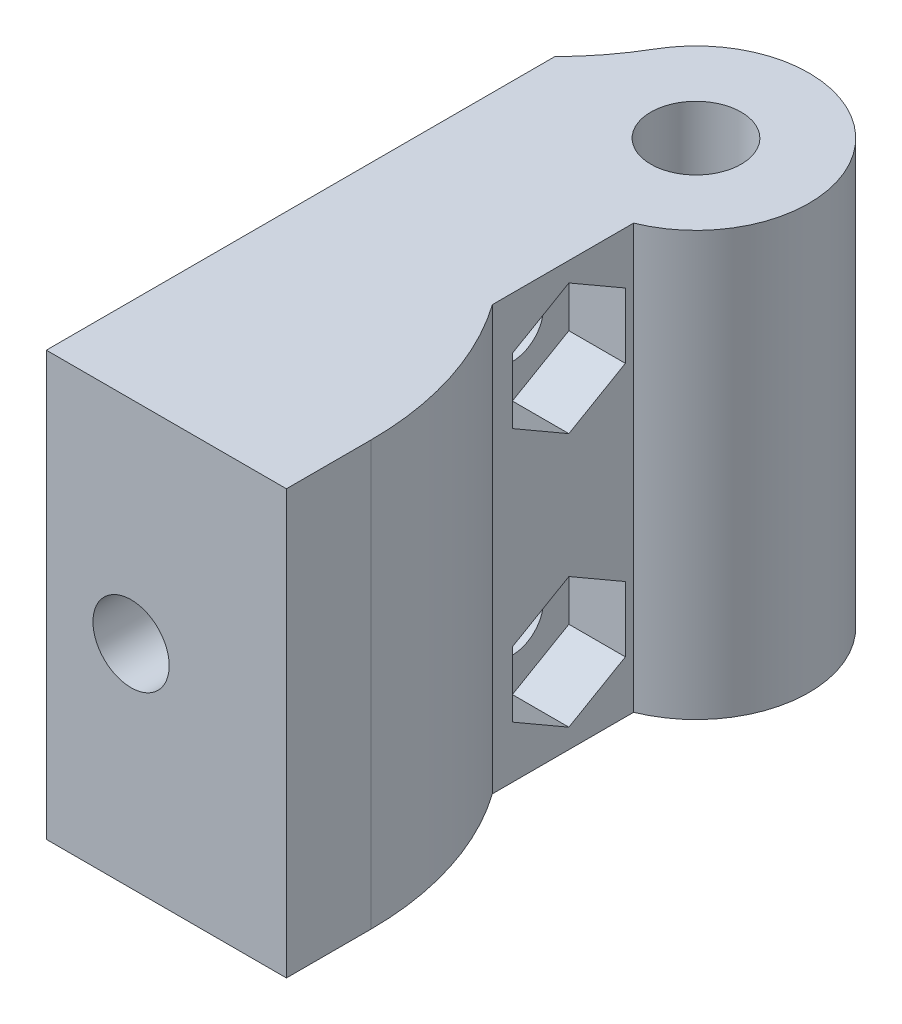
from build123d import *

# Parameters (mm, degrees)
SKETCH_1_R               = 1.6
EXTRUDE_1_DEPTH          = 7.5
CUT_EXTRUDE_1_DEPTH      = 21.554804791
CUT_EXTRUDE_1_DEPTH_BACK = 21.554804791
SKETCH_3_R               = 1.1
FILLET_1_R               = 10
SKETCH_6_R               = 1.35
CUT_EXTRUDE_2_DEPTH      = 4
SKETCH_7_W               = 4
SKETCH_7_H               = 5
CUT_EXTRUDE_3_DEPTH      = 6
CUT_EXTRUDE_4_DEPTH      = 21.554804791
CUT_EXTRUDE_4_DEPTH_BACK = 2


with BuildPart() as part:
    # 草图1 → 凸台-拉伸1 (new, symmetric)
    with BuildSketch(Plane(origin=(0, 0, 0), x_dir=(1, 0, 0), z_dir=(0, 1, 0))):
        with BuildLine():
            Line((-5, -18), (3.5, -18))
            Line((3.5, -18), (3.5, -15))
            ThreePointArc((3.5, -15), (2.987970346, -11.698938991), (1.5, -8.708099244))
            Line((1.5, -8.708099244), (1.5, -3.708099244))
            ThreePointArc((1.5, -3.708099244), (2.236067977, 3.31662479), (-4, 0))
            Line((-4, 0), (-5, 0))
            Line((-5, 0), (-5, -18))
        make_face()
        with Locations(Location((0, 0, 0), (0, 0, 270))):
            Circle(SKETCH_1_R, mode=Mode.SUBTRACT)
    extrude(amount=EXTRUDE_1_DEPTH, both=True)

    # 草图3 → 切除-拉伸1 (cut, two sides: drawn at the far end of the back side and taken through both)
    with BuildSketch(Plane(origin=(1.5, 0, 0), x_dir=(0, 0, -1), z_dir=(1, 0, 0)).offset(-CUT_EXTRUDE_1_DEPTH_BACK)):
        with Locations((-6, 4.5)):
            Circle(SKETCH_3_R)
        with Locations(Location((-6, -4.5, 0), (0, 0, 180))):
            Circle(SKETCH_3_R)
    extrude(amount=CUT_EXTRUDE_1_DEPTH + CUT_EXTRUDE_1_DEPTH_BACK, mode=Mode.SUBTRACT)

    # 圆角1
    # the kernel refuses this fillet: 10 mm, written as the material it adds along each edge
    with BuildSketch(Plane(origin=(-4, 7.5, 0), x_dir=(-1, 0, 0), z_dir=(0, -1, 0))) as fillet_1_piece_1:
        with BuildLine():
            CenterArc((8.1, 7.042016757), FILLET_1_R, 210.198757023, 14.566327648)
            Line((-0.542857143, 2.012004788), (-0.715714286, 1.911404548))
            ThreePointArc((-0.715714286, 1.911404548), (-0.331193265, 0.989877337), (-0.2, 0))
            Line((-0.2, 0), (0, -0.2))
            ThreePointArc((0, -0.2), (0.5, -0.2), (0.858, -0.140840335))
            Line((0.858, -0.140840335), (1, 0))
        make_face()
    extrude(amount=15)

    # 草图6 → 切除-拉伸2 (cut)
    with BuildSketch(Plane.XY.offset(18)):
        with Locations((-2, 0)):
            Circle(SKETCH_6_R)
    extrude(amount=-CUT_EXTRUDE_2_DEPTH, mode=Mode.SUBTRACT)

    # 草图7 → 切除-拉伸3 (cut)
    with BuildSketch(Plane.ZY.offset(5)):
        with Locations((13, 0)):
            Rectangle(SKETCH_7_W, SKETCH_7_H)
    extrude(amount=-CUT_EXTRUDE_3_DEPTH, mode=Mode.SUBTRACT)

    # 草图8 → 切除-拉伸4 (cut, two sides: drawn at the far end of the back side and taken through both)
    with BuildSketch(Plane(origin=(1.5, 0, 0), x_dir=(0, 0, -1), z_dir=(1, 0, 0)).offset(-CUT_EXTRUDE_4_DEPTH_BACK)):
        Polygon((-8, 5.654700538), (-8, 3.345299462), (-6, 2.190598923), (-4, 3.345299462), (-4, 5.654700538), (-6, 6.809401077), align=None)
        Polygon((-6, -6.809401077), (-8, -5.654700538), (-8, -3.345299462), (-6, -2.190598923), (-4, -3.345299462), (-4, -5.654700538), align=None)
    extrude(amount=CUT_EXTRUDE_4_DEPTH + CUT_EXTRUDE_4_DEPTH_BACK, mode=Mode.SUBTRACT)


solid = part.part
